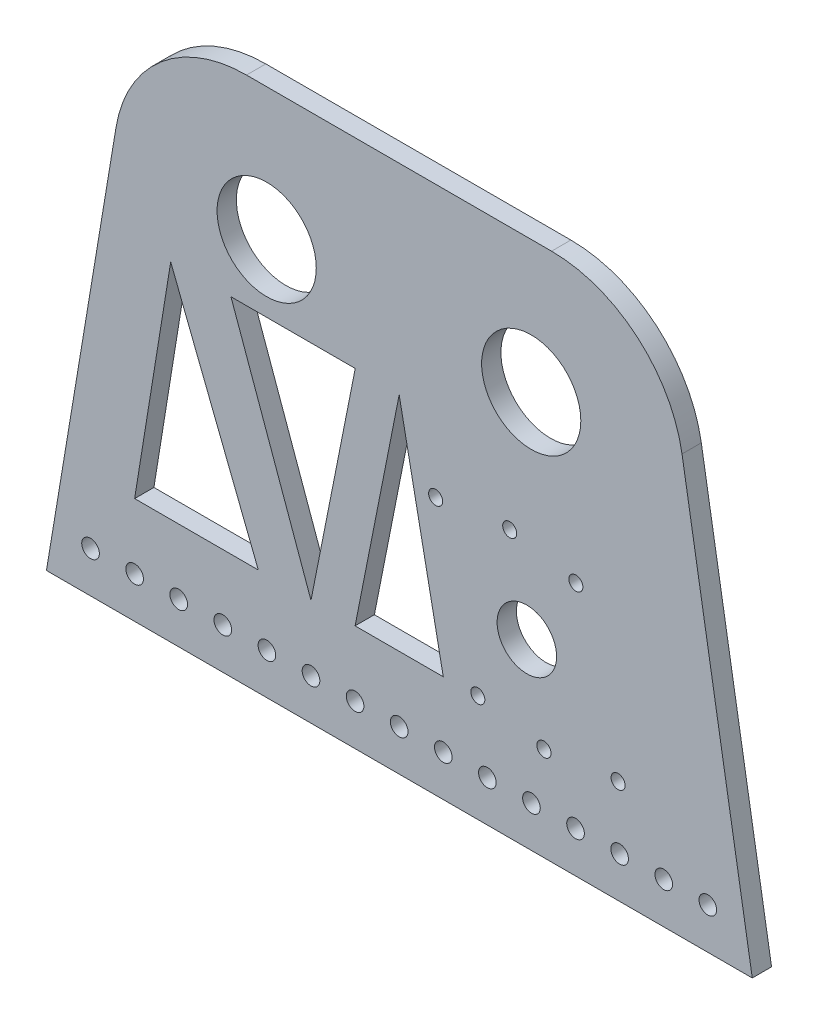
from build123d import *

# Parameters (mm, degrees)
SKETCH2_R           = 14.2875
SKETCH2_R_2         = 2.54
SKETCH2_R_3         = 2.0193
SKETCH2_R_4         = 2.042883772
SKETCH2_R_5         = 8.570756391
BOSS_EXTRUDE1_DEPTH = 5.55625
FILLET1_R           = 38.1


with BuildPart() as part:
    # Sketch2 → Boss-Extrude1 (new body)
    with BuildSketch(Plane.XY):
        Polygon((-33.221954044, -123.033671084), (-58.55568732, -123.033671084), (-33.221954044, 29.366328916), (119.178045956, 29.366328916), (144.745882617, -123.033671084), (119.178045956, -123.033671084), align=None)
        with Locations((4.878045956, -8.733671084)):
            Circle(SKETCH2_R, mode=Mode.SUBTRACT)
        with Locations((81.078045956, -8.733671084)):
            Circle(SKETCH2_R, mode=Mode.SUBTRACT)
        with Locations((-45.85568732, -111.187710863)):
            Circle(SKETCH2_R_2, mode=Mode.SUBTRACT)
        with Locations((-33.15568732, -111.187710863)):
            Circle(SKETCH2_R_2, mode=Mode.SUBTRACT)
        with Locations((-20.45568732, -111.187710863)):
            Circle(SKETCH2_R_2, mode=Mode.SUBTRACT)
        with Locations((-7.75568732, -111.187710863)):
            Circle(SKETCH2_R_2, mode=Mode.SUBTRACT)
        with Locations((4.94431268, -111.187710863)):
            Circle(SKETCH2_R_2, mode=Mode.SUBTRACT)
        with Locations((17.64431268, -111.187710863)):
            Circle(SKETCH2_R_2, mode=Mode.SUBTRACT)
        with Locations((30.34431268, -111.187710863)):
            Circle(SKETCH2_R_2, mode=Mode.SUBTRACT)
        with Locations((43.04431268, -111.187710863)):
            Circle(SKETCH2_R_2, mode=Mode.SUBTRACT)
        with Locations((55.74431268, -111.187710863)):
            Circle(SKETCH2_R_2, mode=Mode.SUBTRACT)
        with Locations((68.44431268, -111.187710863)):
            Circle(SKETCH2_R_2, mode=Mode.SUBTRACT)
        with Locations((81.14431268, -111.187710863)):
            Circle(SKETCH2_R_2, mode=Mode.SUBTRACT)
        with Locations((93.84431268, -111.187710863)):
            Circle(SKETCH2_R_2, mode=Mode.SUBTRACT)
        with Locations((106.54431268, -111.187710863)):
            Circle(SKETCH2_R_2, mode=Mode.SUBTRACT)
        with Locations((119.24431268, -111.187710863)):
            Circle(SKETCH2_R_2, mode=Mode.SUBTRACT)
        with Locations((131.94431268, -111.187710863)):
            Circle(SKETCH2_R_2, mode=Mode.SUBTRACT)
        with Locations((106.095114392, -93.347839884)):
            Circle(SKETCH2_R_3, mode=Mode.SUBTRACT)
        with Locations((53.54416169, -48.740086568)):
            Circle(SKETCH2_R_3, mode=Mode.SUBTRACT)
        with Locations((84.742777137, -95.968518796)):
            Circle(SKETCH2_R_4, mode=Mode.SUBTRACT)
        with Locations((65.698830527, -92.157058574)):
            Circle(SKETCH2_R_3, mode=Mode.SUBTRACT)
        with Locations((74.875343897, -46.129831585)):
            Circle(SKETCH2_R_3, mode=Mode.SUBTRACT)
        with Locations((93.940445554, -49.930867878)):
            Circle(SKETCH2_R_3, mode=Mode.SUBTRACT)
        with Locations((79.818772789, -71.039603253)):
            Circle(SKETCH2_R_5, mode=Mode.SUBTRACT)
        Polygon((-22.767796965, -28.16783361), (-33.15568732, -92.394571291), (2.468038836, -92.394571291), align=None, mode=Mode.SUBTRACT)
        Polygon((43.04431268, -28.399699089), (55.74431268, -92.394571291), (30.34431268, -92.394571291), align=None, mode=Mode.SUBTRACT)
        Polygon((17.64431268, -92.394571291), (30.390327173, -28.16783361), (-5.41538745, -28.16783361), align=None, mode=Mode.SUBTRACT)
    extrude(amount=BOSS_EXTRUDE1_DEPTH)

    # Fillet1
    fillet1_edges = [part.edges().sort_by_distance(p)[0] for p in [
        (-33.221954044, 29.366328916, 2.778125),
        (119.178045956, 29.366328916, 2.778125),
    ]]
    fillet(fillet1_edges, radius=FILLET1_R)


solid = part.part
